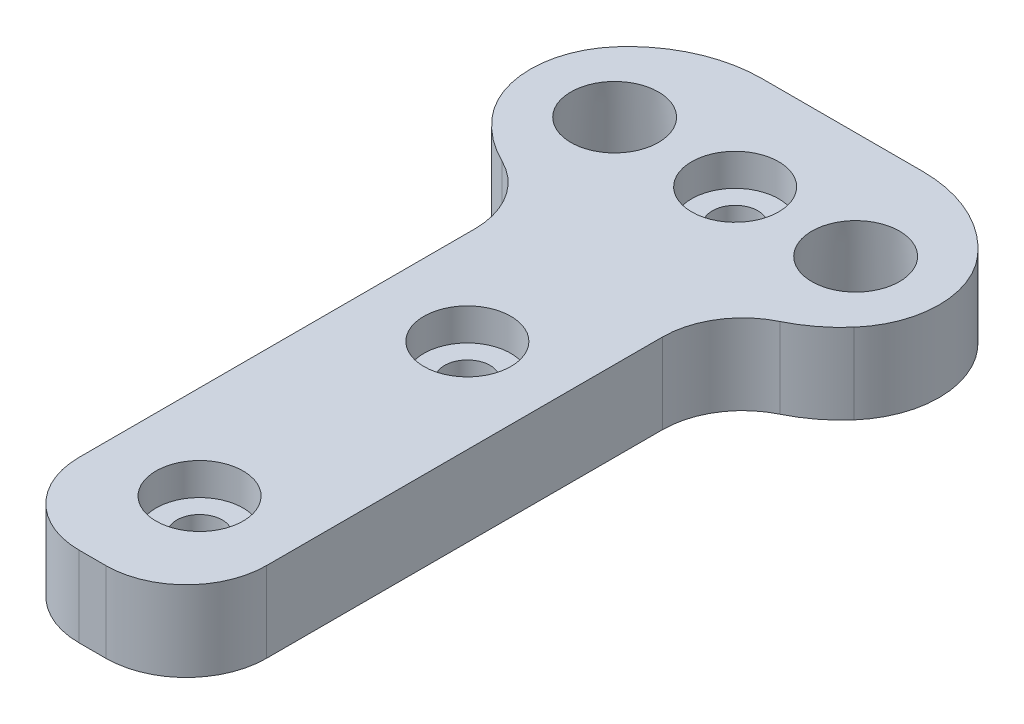
from build123d import *

# Parameters (mm, degrees)
BOSS_EXTRUDE1_DEPTH                          = 3
CBORE_FOR_M5_HEX_HEAD_BOLT1_D                = 1.7
CBORE_FOR_M5_HEX_HEAD_BOLT1_CBORE_D          = 3.25
CBORE_FOR_M5_HEX_HEAD_BOLT1_CBORE_DEPTH      = 1.2
FILLET1_R                                    = 5
FILLET2_R                                    = 3.5
FILLET3_R                                    = 3
CSK_FOR_M2_COUNTERSUNK_FLAT_HEAD_SCR_2_COUNT = 2
CSK_FOR_M2_COUNTERSUNK_FLAT_HEAD_SCR_2_PITCH = 9


with BuildPart() as part:
    # Sketch1 → Boss-Extrude1 (new body)
    with BuildSketch(Plane(origin=(0, 0, 0), x_dir=(1, 0, 0), z_dir=(0, 1, 0))):
        Polygon((3.5, 6), (8, 6), (8, 14), (-8, 14), (-8, 6), (-3.5, 6), (-3.5, -14), (3.5, -14), align=None)
    extrude(amount=BOSS_EXTRUDE1_DEPTH)

    # CBORE for M5 Hex Head Bolt1 (through all)
    with Locations(Plane(origin=(0, 3, 0), x_dir=(1, 0, 0), z_dir=(0, 1, 0))):
        with Locations((0, 10), (0, 0), (0, -10)):
            CounterBoreHole(CBORE_FOR_M5_HEX_HEAD_BOLT1_D / 2, CBORE_FOR_M5_HEX_HEAD_BOLT1_CBORE_D / 2, CBORE_FOR_M5_HEX_HEAD_BOLT1_CBORE_DEPTH)

    # Fillet1
    # the kernel refuses this fillet: 5 mm, written as the material it takes off along each edge
    with BuildSketch(Plane(origin=(-8, -12.437342964, -6), x_dir=(0, 0, -1), z_dir=(0, 1, 0))) as fillet1_piece_1:
        with BuildLine():
            CenterArc((4.974937186, -5), FILLET1_R, 90, 84.260829523)
            Line((0, -4.5), (-0.099498744, -4.49))
            ThreePointArc((-0.099498744, -4.49), (-0.1, -2.25), (-0.1, 0))
            Line((-0.1, 0), (0, 0.1))
            Line((0, 0.1), (4.974937186, 0.1))
            Line((4.974937186, 0.1), (4.974937186, 0))
        make_face()
    extrude(amount=27.874685928, mode=Mode.SUBTRACT)
    with BuildSketch(Plane(origin=(-8, -12.5, -14), x_dir=(1, 0, 0), z_dir=(0, 1, 0)), Plane(origin=(8, -12.5, -14), x_dir=(0, 0, 1), z_dir=(0, 1, 0))) as fillet1_piece_2:
        with BuildLine():
            CenterArc((FILLET1_R, -FILLET1_R), FILLET1_R, 90, 90)
            Line((0, -FILLET1_R), (-FILLET1_R * 0.02, -FILLET1_R))
            Line((-FILLET1_R * 0.02, -FILLET1_R), (-FILLET1_R * 0.02, FILLET1_R * 0.02))
            Line((-FILLET1_R * 0.02, FILLET1_R * 0.02), (FILLET1_R, FILLET1_R * 0.02))
            Line((FILLET1_R, FILLET1_R * 0.02), (FILLET1_R, 0))
        make_face()
    extrude(amount=28, mode=Mode.SUBTRACT)
    with BuildSketch(Plane(origin=(8, -12.437342964, -6), x_dir=(-1, 0, 0), z_dir=(0, 1, 0))) as fillet1_piece_3:
        with BuildLine():
            CenterArc((5, -4.974937186), FILLET1_R, 95.739170477, 84.260829523)
            Line((0, -4.974937186), (-0.1, -4.974937186))
            Line((-0.1, -4.974937186), (-0.1, 0))
            Line((-0.1, 0), (0, 0.1))
            ThreePointArc((0, 0.1), (2.25, 0.1), (4.49, 0.099498744))
            Line((4.49, 0.099498744), (4.5, 0))
        make_face()
    extrude(amount=27.874685928, mode=Mode.SUBTRACT)

    # Fillet2
    fillet2_edges = [part.edges().sort_by_distance(p)[0] for p in [
        (-7.901520762, 1.5, -9.987468593),
        (7.901520762, 1.5, -9.987468593),
    ]]
    fillet(fillet2_edges, radius=FILLET2_R)

    # Fillet3
    fillet3_edges = [part.edges().sort_by_distance(p)[0] for p in [
        (3.5, 1.5, -6),
        (3.5, 1.5, 14),
        (-3.5, 1.5, 14),
        (-3.5, 1.5, -6),
    ]]
    fillet(fillet3_edges, radius=FILLET3_R)

    # Sketch8 → CSK for M2 Countersunk Flat Head Screw2 (revolve, cut)
    with BuildSketch(Plane(origin=(-4.5, 0, -10), x_dir=(0, 0, -1), z_dir=(1, 0, 0))):
        Polygon((0, 0), (0, 3), (1.6, 3), (1.6, 3.375254051), (1.925, 0), align=None)
    csk_for_m2_countersunk_flat_head_screw2 = revolve(axis=Axis((-4.5, -6.35, -10), (0, 1, 0)), mode=Mode.SUBTRACT)

    # CSK for M2 Countersunk Flat Head Scr 2: CSK for M2 Countersunk Flat Head Screw2 ×2
    with Locations(*[(i * CSK_FOR_M2_COUNTERSUNK_FLAT_HEAD_SCR_2_PITCH, 0, 0) for i in range(1, CSK_FOR_M2_COUNTERSUNK_FLAT_HEAD_SCR_2_COUNT)]):
        add(csk_for_m2_countersunk_flat_head_screw2, mode=Mode.SUBTRACT)


solid = part.part
